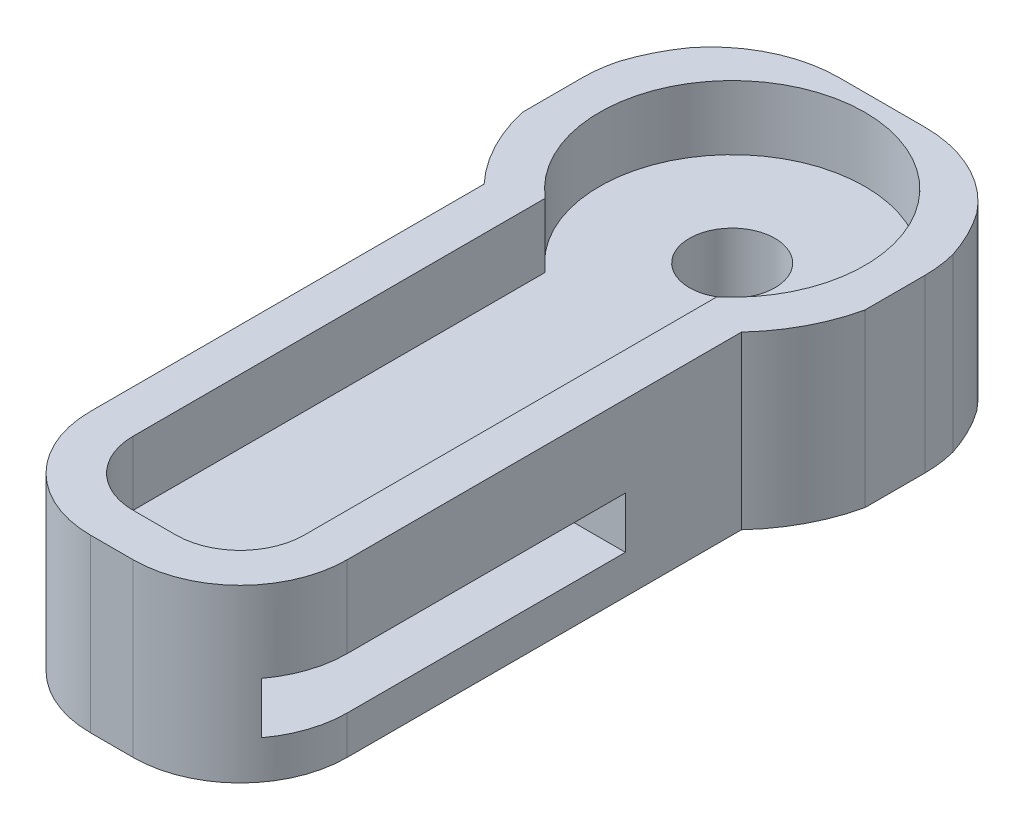
from build123d import *

# Parameters (mm, degrees)
SKETCH_1_W          = 8
SKETCH_1_H          = 18
EXTRUDE_1_DEPTH     = 4
CUT_EXTRUDE_4_DEPTH = 1.5
SKETCH_6_W          = 8
SKETCH_6_H          = 1.2
CUT_EXTRUDE_5_DEPTH = 13.68857754
SKETCH_7_R          = 1
CUT_EXTRUDE_6_DEPTH = 11.161200716
FILLET_1_R          = 3
FILLET_2_R          = 2
FILLET_3_R          = 1.5
CUT_EXTRUDE_START   = -4
CUT_EXTRUDE_7_DEPTH = 4


# Read off the part's stored shape, not the designer's step: 切除-拉伸7
with BuildPart() as part:
    # 草图1 → 凸台-拉伸1 (new body)
    with BuildSketch(Plane(origin=(0, 0, 0), x_dir=(1, 0, 0), z_dir=(0, 1, 0))):
        Rectangle(SKETCH_1_W, SKETCH_1_H)
    extrude(amount=EXTRUDE_1_DEPTH)

    # 草图5 → 切除-拉伸4 (cut)
    with BuildSketch(Plane(origin=(0, 4, 0), x_dir=(1, 0, 0), z_dir=(0, 1, 0))):
        with BuildLine():
            Line((2.005613872, -8), (-1.994386128, -8))
            Line((-1.994386128, -8), (-1.994386128, 3.12672716))
            ThreePointArc((-1.994386128, 3.12672716), (-0.007347569, 8.599991292), (2.005613872, 3.136207921))
            Line((2.005613872, 3.136207921), (2.005613872, -8))
        make_face()
    extrude(amount=-CUT_EXTRUDE_4_DEPTH, mode=Mode.SUBTRACT)

    # 草图6 → 切除-拉伸5 (cut, through all)
    with BuildSketch(Plane(origin=(4, 0, 0), x_dir=(0, 0, -1), z_dir=(1, 0, 0))):
        with Locations((-4, 1.5)):
            Rectangle(SKETCH_6_W, SKETCH_6_H)
    extrude(amount=-CUT_EXTRUDE_5_DEPTH, mode=Mode.SUBTRACT)

    # 草图7 → 切除-拉伸6 (cut, through all)
    with BuildSketch(Plane(origin=(0, 2.5, 0), x_dir=(1, 0, 0), z_dir=(0, 1, 0))):
        with Locations(Location((0, 5.5, 0), (0, 0, 270))):
            Circle(SKETCH_7_R)
    extrude(amount=-CUT_EXTRUDE_6_DEPTH, mode=Mode.SUBTRACT)

    # 圆角1
    fillet_1_edges = [part.edges().sort_by_distance(p)[0] for p in [
        (-4, 2, -9),
        (4, 2, -9),
    ]]
    fillet(fillet_1_edges, radius=FILLET_1_R)

    # 圆角2
    # the kernel refuses this fillet: 2 mm, written as the material it takes off along each edge
    with BuildSketch(Plane(origin=(4, -5, 9), x_dir=(0, 0, -1), z_dir=(0, 1, 0)), Plane(origin=(-4, -5, 9), x_dir=(1, 0, 0), z_dir=(0, 1, 0))) as fillet_2_piece_1:
        with BuildLine():
            CenterArc((FILLET_2_R, FILLET_2_R), FILLET_2_R, 180, 90)
            Line((0, FILLET_2_R), (0, 0))
            Line((0, 0), (FILLET_2_R, 0))
        make_face()
    extrude(amount=14, mode=Mode.SUBTRACT)

    # 圆角3
    fillet_3_edges = [part.edges().sort_by_distance(p)[0] for p in [
        (2.005613872, 3.25, 8),
        (-1.994386128, 3.25, 8),
    ]]
    fillet(fillet_3_edges, radius=FILLET_3_R)

    # 切除-拉伸7 outline → 切除-拉伸7 (cut)
    with BuildSketch(Plane(origin=(0, 4, 0), x_dir=(1, 0, 0), z_dir=(0, 1, 0)).offset(CUT_EXTRUDE_START)):
        with BuildLine():
            ThreePointArc((-3.34354323, 7.872913541), (-3.683281573, 7.341640787), (-3.904456771, 6.751086459))
            ThreePointArc((-3.904456771, 6.751086459), (-3.667151483, 7.333575742), (-3.34354323, 7.872913541))
        make_face()
        with BuildLine():
            ThreePointArc((3.34354323, 7.872913541), (3.667151483, 7.333575742), (3.90445677, 6.751086459))
            ThreePointArc((3.90445677, 6.751086459), (3.683281573, 7.341640787), (3.34354323, 7.872913541))
        make_face()
        with BuildLine():
            ThreePointArc((-2.994386128, 2.699347983), (-3.62401419, 3.582574342), (-4, 4.6))
            Line((-4, 4.6), (-4, -7))
            ThreePointArc((-4, -7), (-3.414213562, -8.414213562), (-2, -9))
            Line((-2, -9), (-0.494386128, -9))
            ThreePointArc((-0.494386128, -9), (-2.262153081, -8.267766953), (-2.994386128, -6.5))
            Line((-2.994386128, -6.5), (-2.994386128, 2.699347983))
        make_face()
        with BuildLine():
            Line((4, -7), (4, 4.6))
            ThreePointArc((4, 4.6), (3.627858614, 3.589858153), (3.005613872, 2.711400845))
            Line((3.005613872, 2.711400845), (3.005613872, -6.5))
            ThreePointArc((3.005613872, -6.5), (2.273380825, -8.267766953), (0.505613872, -9))
            Line((0.505613872, -9), (2, -9))
            ThreePointArc((2, -9), (3.414213562, -8.414213562), (4, -7))
        make_face()
    extrude(amount=CUT_EXTRUDE_7_DEPTH, mode=Mode.SUBTRACT)


solid = part.part
